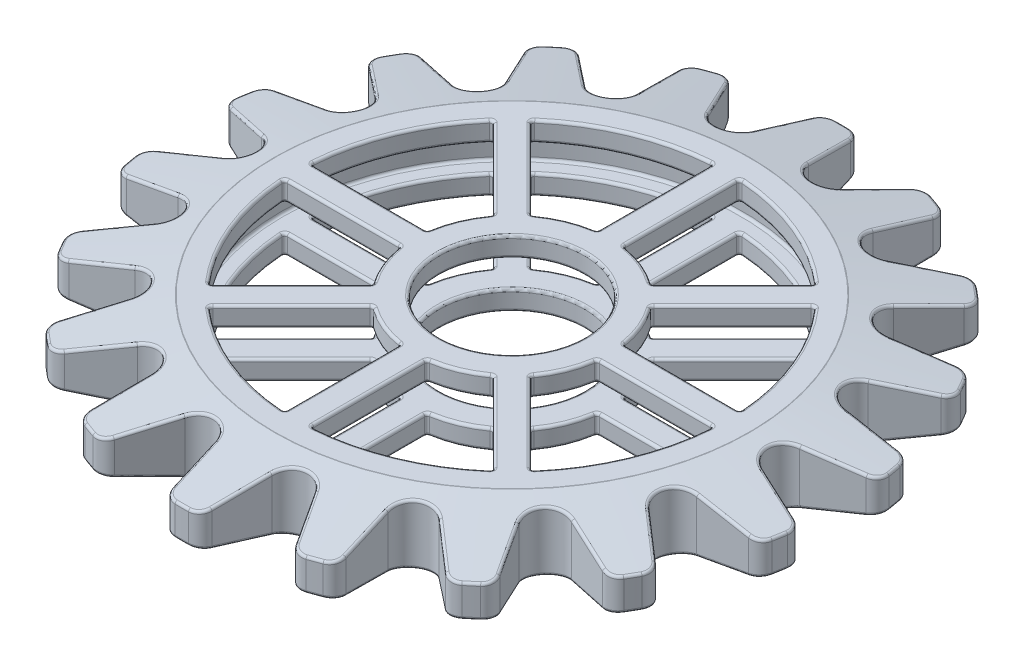
from build123d import *

# Parameters (mm, degrees)
SKETCH_6_W                       = 17.5
SKETCH_6_H                       = 9.999999999999998
CUT_REVOLVE_5_ANGLE              = 90.0000000000002
REVOLVE_2_ANGLE                  = 90.0000000000002
PATTERN_CIRCULAR_2_COUNT         = 4
PATTERN_CIRCULAR_3_COUNT         = 8
CUT_REVOLVE_START                = -5
CUT_REVOLVE_1_DEPTH              = 10
FILLET_1_R                       = 2
FILLET_2_R                       = 3
PATTERN_CIRCULAR_5_COUNT         = 18
FILLET_1_OF_PATTERN_CIRCULAR_5_R = 2
FILLET_2_OF_PATTERN_CIRCULAR_5_R = 3
FILLET_3_R                       = 0.4


with BuildPart() as part:
    # Эскиз1 → Повернуть1 (revolve)
    with BuildSketch(Plane.XY, mode=Mode.PRIVATE) as revolve_1_sk:
        Polygon((0, -5), (50, -5), (50, 4.999999999999999), (0, 5), align=None)
    revolve(revolve_1_sk.sketch.rotate(Axis((0, -5, 0), (0, 1, 0)), 90), axis=Axis((0, -5, 0), (0, 1, 0)))

    # Эскиз6 → Вырез-Повернуть5 (revolve, cut)
    with BuildSketch(Plane.XY):
        with Locations((23.75, -8.9e-16)):
            Rectangle(SKETCH_6_W, SKETCH_6_H)
    cut_revolve_5 = revolve(axis=Axis((0, -5, 0), (0, -1, 0)), revolution_arc=CUT_REVOLVE_5_ANGLE, mode=Mode.SUBTRACT)

    # Эскиз9 → Повернуть2 (revolve)
    with BuildSketch(Plane(origin=(0, 4.999999999999999, 0), x_dir=(1, 0, 0), z_dir=(0, 1, 0))):
        Polygon((26.87005768508882, -29.698484809834984), (5.656854249492397, -8.485281374238571), (8.485281374238587, -5.656854249492381), (29.698484809835012, -26.8700576850888), align=None)
    revolve_2 = revolve(axis=Axis((5.656854249492397, 4.999999999999999, 8.485281374238571), (0.7071067811865476, 0, -0.7071067811865476)), revolution_arc=REVOLVE_2_ANGLE)

    # Круговой массив2: Вырез-Повернуть5, Повернуть2 ×4 about axis
    pattern_circular_2_axis = Axis((-3e-17, 0, -2.3e-16), (0, 1, 0))
    add([cut_revolve_5.rotate(pattern_circular_2_axis, i * 360 / PATTERN_CIRCULAR_2_COUNT) for i in range(1, PATTERN_CIRCULAR_2_COUNT)], mode=Mode.SUBTRACT)
    add([revolve_2.rotate(pattern_circular_2_axis, i * 360 / PATTERN_CIRCULAR_2_COUNT) for i in range(1, PATTERN_CIRCULAR_2_COUNT)])

    # Круговой массив3: Повернуть2 ×8 about axis
    pattern_circular_3_axis = Axis((5.8e-16, 0, 2.4e-16), (0, 1, 0))
    for i in range(1, PATTERN_CIRCULAR_3_COUNT):
        add(revolve_2.rotate(pattern_circular_3_axis, i * 360 / PATTERN_CIRCULAR_3_COUNT))

    # Эскиз10 → Вырез-Повернуть6 (revolve, cut)
    with BuildSketch(Plane.XY):
        Polygon((0, -4.9999999999999964), (-50, -5), (-49.99999999999999, -34.99999999999999), (3.69e-15, -34.99999999999999), align=None)
    revolve(axis=Axis((0, -4.9999999999999964, 0), (1.2e-16, -1, 0)), mode=Mode.SUBTRACT)

    # Вырез-Повернуть1: read off the stored shape, not the designer's step
    # Вырез-Повернуть1 outline → Вырез-Повернуть1 (cut)
    with BuildSketch(Plane(origin=(0, 0, 0), x_dir=(1, 0, 0), z_dir=(0, 1, 0)).offset(CUT_REVOLVE_START)):
        with BuildLine():
            Line((-49.632183975, -6.053619898), (-33, 0))
            Line((-33, 0), (-49.632183975, 6.053619898))
            ThreePointArc((-49.632183975, 6.053619898), (-50, 0), (-49.632183975, -6.053619898))
        make_face()
    cut_revolve_1 = extrude(amount=CUT_REVOLVE_1_DEPTH, mode=Mode.SUBTRACT)

    # Скругление1
    fillet_1_edges = [part.edges().sort_by_distance(p)[0] for p in [
        (-49.632183975000004, 0, -6.053619898000001),
        (-49.63218397499999, 0, 6.053619898),
    ]]
    fillet(fillet_1_edges, radius=FILLET_1_R)

    # Скругление2
    fillet_2_edges = [part.edges().sort_by_distance(p)[0] for p in [
        (-33, 0, 0),
    ]]
    fillet(fillet_2_edges, radius=FILLET_2_R)

    # Эскиз5 → Вырез-Повернуть2 (revolve, cut)
    with BuildSketch(Plane(origin=(0, 0, 0), x_dir=(0, 0, -1), z_dir=(1, 0, 0)), mode=Mode.PRIVATE) as cut_revolve_2_sk:
        Polygon((0, 4.999999999999998), (-11, 5.000000000000007), (-10.999999999999998, -4.999999999999998), (0, -5), align=None)
    revolve(cut_revolve_2_sk.sketch.rotate(Axis((0, -5, 0), (0, 1, 0)), 180), axis=Axis((0, -5, 0), (0, 1, 0)), mode=Mode.SUBTRACT)

    # Круговой массив5: Вырез-Повернуть1 ×18 about axis
    pattern_circular_5_axis = Axis((4.6e-16, 0, -1.243e-14), (0, 1, 0))
    for i in range(1, PATTERN_CIRCULAR_5_COUNT):
        add(cut_revolve_1.rotate(pattern_circular_5_axis, i * 360 / PATTERN_CIRCULAR_5_COUNT), mode=Mode.SUBTRACT)

    # Скругление1 of Круговой массив5
    fillet_1_of_pattern_circular_5_edges = [part.edges().sort_by_distance(p)[0] for p in [
        (-48.709456979949195, 0, 11.286664729502117),
        (-44.568537089643016, 0, 22.663748623888797),
        (-41.91165059809383, 0, 27.265611017195432),
        (-34.129266869721235, 0, 36.54029478443017),
        (-30.05868060402296, 0, 39.95592221865291),
        (-19.57350337097703, 0, 46.0095421166529),
        (-14.580190110227937, 0, 47.826959513932294),
        (-2.6568864915491908, 0, 49.92935964108422),
        (2.6568864915492116, 0, 49.929359641084226),
        (14.580190110227955, 0, 47.82695951393227),
        (19.57350337097704, 0, 46.0095421166529),
        (30.058680604022957, 0, 39.955922218652894),
        (34.129266869721256, 0, 36.54029478443017),
        (41.91165059809382, 0, 27.26561101719542),
        (44.56853708964304, 0, 22.663748623888786),
        (48.70945697994919, 0, 11.286664729502098),
        (49.632183975000004, 0, 6.053619897999982),
        (49.63218397499999, 0, -6.053619898000019),
        (48.7094569799492, 0, -11.286664729502139),
        (44.56853708964302, 0, -22.663748623888818),
        (41.91165059809383, 0, -27.265611017195457),
        (34.129266869721235, 0, -36.540294784430195),
        (30.058680604022975, 0, -39.95592221865293),
        (19.573503370977047, 0, -46.00954211665292),
        (14.580190110227933, 0, -47.826959513932316),
        (2.6568864915491863, 0, -49.92935964108424),
        (-2.6568864915491948, 0, -49.92935964108426),
        (-14.580190110227937, 0, -47.82695951393231),
        (-19.573503370977058, 0, -46.00954211665293),
        (-30.058680604022975, 0, -39.95592221865291),
        (-34.12926686972124, 0, -36.5402947844302),
        (-41.91165059809382, 0, -27.265611017195447),
        (-44.568537089643044, 0, -22.663748623888797),
        (-48.709456979949195, 0, -11.286664729502109),
    ]]
    fillet(fillet_1_of_pattern_circular_5_edges, radius=FILLET_1_OF_PATTERN_CIRCULAR_5_R)

    # Скругление2 of Круговой массив5
    fillet_2_of_pattern_circular_5_edges = [part.edges().sort_by_distance(p)[0] for p in [
        (-31.009856485934975, 0, 11.286664729747068),
        (-25.279466622926268, 0, 21.211991119655792),
        (-16.499999999999993, 0, 28.578838324886465),
        (-5.730389863008691, 0, 32.49865584940286),
        (5.730389863008712, 0, 32.49865584940285),
        (16.500000000000004, 0, 28.57883832488646),
        (25.27946662292628, 0, 21.21199111965578),
        (31.00985648593498, 0, 11.28666472974705),
        (33, 0, -2.083e-14),
        (31.009856485934975, 0, -11.286664729747091),
        (25.279466622926268, 0, -21.211991119655817),
        (16.500000000000004, 0, -28.578838324886483),
        (5.730389863008689, 0, -32.49865584940288),
        (-5.730389863008701, 0, -32.49865584940288),
        (-16.500000000000014, 0, -28.57883832488648),
        (-25.279466622926275, 0, -21.21199111965581),
        (-31.009856485934982, 0, -11.286664729747066),
    ]]
    fillet(fillet_2_of_pattern_circular_5_edges, radius=FILLET_2_OF_PATTERN_CIRCULAR_5_R)

    # Эскиз11 → Вырез-Повернуть7 (revolve, cut)
    with BuildSketch(Plane.XY, mode=Mode.PRIVATE) as cut_revolve_7_sk:
        Polygon((35, -1.9999999999999922), (-4.9e-16, -2.000000000000003), (0, 1.9999999999999971), (35, 2.000000000000008), align=None)
    revolve(cut_revolve_7_sk.sketch.rotate(Axis((-4.9e-16, -2.000000000000003, 0), (1.2e-16, 1, 0)), 90), axis=Axis((-4.9e-16, -2.000000000000003, 0), (1.2e-16, 1, 0)), mode=Mode.SUBTRACT)

    # Эскиз12 → Вырез-Повернуть9 (revolve, cut)
    with BuildSketch(Plane(origin=(0, 0, 0), x_dir=(0, 0, -1), z_dir=(1, 0, 0)), mode=Mode.PRIVATE) as cut_revolve_9_sk:
        Polygon((-20, 8), (-52.00000000000001, 2), (-52.00000000000001, 10), (-20, 10), align=None)
    cut_revolve_9 = revolve(cut_revolve_9_sk.sketch.rotate(Axis((0, -5, 0), (0, -1, 0)), 270), axis=Axis((0, -5, 0), (0, -1, 0)), mode=Mode.SUBTRACT)

    # Зеркальное отражение1: Вырез-Повернуть9 across plane
    add(cut_revolve_9.mirror(Plane.ZX), mode=Mode.SUBTRACT)

    # Скругление3
    fillet_3_edges = [part.edges().sort_by_distance(p)[0] for p in [
        (-1.9999999999999885, 3.499999999999998, 32.438403166617185),
        (-1.9999999999999847, -3.499999999999994, 14.86606874731851),
        (2.0000000000000093, 3.4999999999999964, 14.866068747318506),
        (2.0000000000000053, -3.4999999999999947, 32.438403166617185),
        (-30.026084806616446, 4.999999999999998, -12.437211551866323),
        (-32.438403166617185, 3.4999999999999996, -1.9999999999999856),
        (-14.86606874731851, -3.499999999999993, -1.9999999999999836),
        (-14.866068747318506, 3.4999999999999982, 2.00000000000001),
        (-32.438403166617185, -3.499999999999991, 2.0000000000000084),
        (1.9999999999999856, 3.4999999999999973, -32.438403166617185),
        (1.9999999999999836, -3.4999999999999942, -14.86606874731851),
        (-13.858192987669472, 4.999999999999998, -5.740251485475931),
        (-2.0000000000000093, 3.4999999999999982, -14.866068747318506),
        (-2.0000000000000075, -3.4999999999999947, -32.438403166617185),
        (32.438403166617185, 3.4999999999999956, 1.9999999999999851),
        (14.86606874731851, -3.4999999999999947, 1.9999999999999831),
        (14.866068747318506, 3.4999999999999964, -2.0000000000000098),
        (32.438403166617185, -3.4999999999999964, -2.000000000000008),
        (-24.351628412351275, 3.499999999999999, 21.523201287605104),
        (-11.926111583187406, -3.4999999999999933, 9.097684458441238),
        (-9.097684458441218, 3.4999999999999982, 11.92611158318742),
        (-21.52320128760509, -3.499999999999993, 24.35162841235129),
        (-21.523201287605104, 3.499999999999999, -24.351628412351275),
        (-9.09768445844124, -3.4999999999999933, -11.926111583187406),
        (-11.926111583187422, 3.4999999999999982, -9.097684458441218),
        (-24.35162841235129, -3.499999999999993, -21.52320128760509),
        (24.351628412351275, 3.499999999999996, -21.523201287605104),
        (11.926111583187406, -3.4999999999999947, -9.09768445844124),
        (9.097684458441218, 3.4999999999999964, -11.926111583187422),
        (21.52320128760509, -3.4999999999999947, -24.35162841235129),
        (21.523201287605108, 3.4999999999999964, 24.35162841235127),
        (9.097684458441242, -3.4999999999999947, 11.926111583187405),
        (11.926111583187422, 3.4999999999999964, 9.097684458441217),
        (24.351628412351292, -3.4999999999999947, 21.523201287605087),
        (-30.026084806616815, -5, -12.437211551865417),
        (13.858192987669364, -1.999999999999988, -5.740251485476198),
        (18.13886999776932, -1.99999999999999, -15.310442873023153),
        (30.026084806616677, -1.9999999999999876, -12.437211551865756),
        (23.652235956967846, -1.9999999999999905, -2.0000000000000084),
        (30.02608480661671, -1.9999999999999876, 12.43721155186569),
        (18.138869997769337, -1.999999999999991, 15.310442873023131),
        (13.858192987669376, -1.999999999999988, 5.740251485476172),
        (23.65223595696785, -1.9999999999999905, 1.9999999999999842),
        (-5.740251485476192, -1.999999999999988, -13.858192987669367),
        (-15.31044287302315, -1.999999999999986, -18.13886999776932),
        (-12.437211551865754, -1.9999999999999876, -30.026084806616677),
        (-2.0000000000000084, -1.999999999999988, -23.652235956967846),
        (12.437211551865692, -1.9999999999999876, -30.02608480661671),
        (15.310442873023135, -1.9999999999999896, -18.13886999776934),
        (5.740251485476167, -1.999999999999988, -13.858192987669378),
        (1.9999999999999847, -1.9999999999999885, -23.65223595696785),
        (-13.858192987669367, -1.999999999999988, 5.7402514854761915),
        (-18.138869997769326, -1.9999999999999856, 15.310442873023156),
        (-30.02608480661668, -1.9999999999999876, 12.437211551865753),
        (-23.652235956967846, -1.9999999999999851, 2.0000000000000093),
        (-30.026084806616705, -1.9999999999999876, -12.437211551865694),
        (-18.13886999776934, -1.9999999999999856, -15.310442873023135),
        (-13.858192987669376, -1.999999999999988, -5.74025148547617),
        (-23.65223595696785, -1.9999999999999851, -1.9999999999999847),
        (5.740251485476178, -1.999999999999988, 13.858192987669373),
        (15.310442873023153, -1.9999999999999905, 18.138869997769316),
        (12.437211551865726, -1.9999999999999876, 30.026084806616694),
        (2.0000000000000075, -1.9999999999999885, 23.652235956967846),
        (-12.437211551865696, -1.9999999999999876, 30.026084806616705),
        (-15.310442873023137, -1.999999999999986, 18.138869997769337),
        (-5.7402514854761835, -1.999999999999988, 13.858192987669371),
        (-1.9999999999999867, -1.999999999999988, 23.65223595696785),
        (4.88e-15, -1.9999999999999876, 11),
        (30.026084806616677, 1.999999999999997, -12.437211551865756),
        (18.13886999776932, 1.999999999999995, -15.310442873023153),
        (13.858192987669364, 1.9999999999999964, -5.740251485476198),
        (23.652235956967846, 1.9999999999999942, -2.0000000000000084),
        (13.858192987669376, 1.9999999999999964, 5.740251485476172),
        (18.138869997769337, 1.9999999999999944, 15.310442873023131),
        (30.02608480661671, 1.999999999999997, 12.43721155186569),
        (23.65223595696785, 1.9999999999999942, 1.9999999999999842),
        (-12.437211551865754, 1.999999999999997, -30.026084806616677),
        (-15.31044287302315, 1.999999999999999, -18.13886999776932),
        (-5.740251485476192, 1.9999999999999964, -13.858192987669367),
        (-2.0000000000000084, 1.999999999999997, -23.652235956967846),
        (5.740251485476167, 1.9999999999999964, -13.858192987669378),
        (15.310442873023135, 1.999999999999995, -18.13886999776934),
        (12.437211551865692, 1.999999999999997, -30.02608480661671),
        (1.9999999999999847, 1.999999999999997, -23.65223595696785),
        (-30.02608480661668, 1.999999999999997, 12.437211551865753),
        (-18.138869997769326, 1.999999999999999, 15.310442873023156),
        (-13.858192987669367, 1.9999999999999964, 5.7402514854761915),
        (-23.652235956967846, 1.9999999999999996, 2.0000000000000093),
        (-13.858192987669376, 1.9999999999999964, -5.74025148547617),
        (-18.13886999776934, 1.999999999999999, -15.310442873023135),
        (-30.026084806616705, 1.999999999999997, -12.437211551865694),
        (-23.65223595696785, 1.9999999999999996, -1.9999999999999847),
        (12.437211551865726, 1.999999999999997, 30.026084806616694),
        (15.310442873023153, 1.9999999999999944, 18.138869997769316),
        (5.740251485476178, 1.9999999999999964, 13.858192987669373),
        (2.0000000000000075, 1.999999999999997, 23.652235956967846),
        (-5.7402514854761835, 1.9999999999999964, 13.858192987669371),
        (-15.310442873023137, 1.999999999999999, 18.138869997769337),
        (-12.437211551865696, 1.999999999999997, 30.026084806616705),
        (-1.9999999999999867, 1.999999999999997, 23.652235956967843),
        (4.88e-15, 1.999999999999997, 11),
        (-8.66e-15, -1.999999999999988, 35),
        (-8.17e-15, 2.000000000000013, 35),
        (-13.858192987669305, -5, -5.740251485476336),
        (-36.43321088161458, 4.480360024970334, 13.260604299699795),
        (-11.926111583187422, -3.4999999999999933, -9.097684458441218),
        (-24.35162841235129, 3.499999999999999, -21.52320128760509),
        (-9.09768445844124, 3.4999999999999982, -11.926111583187406),
        (-21.523201287605104, -3.499999999999993, -24.351628412351275),
        (-18.138869997769337, 4.999999999999999, -15.31044287302313),
        (-15.310442873023149, 4.999999999999999, -18.138869997769323),
        (-36, 5, 1.24e-14),
        (36.43321088164581, 4.480360024970332, -13.260604299614013),
        (43.17304789030424, 3.3830010738551834, -11.286664729578758),
        (39.3188977556951, 4.370592419255255, 1.7277639108030243),
        (44.429661207834805, 3.3830010738551852, 4.1600564675780785),
        (36.43321088164582, 4.480360024970335, 13.260604299613975),
        (40.32740167173636, 3.3830010738551852, 19.105013458850372),
        (29.700625633880474, 4.480360024970332, 24.92178401506396),
        (31.361062324965133, 3.3830010738551852, 31.745623867016263),
        (19.385706600118738, 4.480360024970339, 33.577028771937634),
        (18.61211602181702, 3.383001073855187, 40.55724352130998),
        (6.73258524782404, 4.480360024970335, 38.18238831474788),
        (3.6182738408601454, 3.383001073855187, 44.47706104576791),
        (-6.732585247734101, 4.480360024970332, 38.18238831476376),
        (-11.811985565339114, 3.3830010738551834, 43.032288596595),
        (-19.385706600039647, 4.480360024970334, 33.577028771983294),
        (-25.817545186017785, 3.3830010738551834, 36.3971870537319),
        (-29.700625633821787, 4.480360024970332, 24.921784015133927),
        (-36.70912783087621, 3.3830010738551852, 25.372047586917525),
        (-43.17304789030424, 3.3830010738551817, 11.286664729578735),
        (-38.77141320015838, 4.480360024970334, 4.564915e-11),
        (-44.42966120783482, 3.3830010738551817, -4.160056467578096),
        (-36.433210881614585, 4.480360024970332, -13.260604299699796),
        (-40.32740167173638, 3.38300107385518, -19.105013458850397),
        (-29.700625633821776, 4.480360024970331, -24.921784015133937),
        (-31.361062324965133, 3.38300107385518, -31.745623867016285),
        (-19.385706600039658, 4.480360024970331, -33.577028771983294),
        (-18.612116021817037, 3.383001073855187, -40.557243521309985),
        (-6.732585247734104, 4.480360024970332, -38.182388314763784),
        (-3.618273840860133, 3.3830010738551834, -44.47706104576794),
        (6.732585247824023, 4.480360024970333, -38.182388314747904),
        (11.811985565339091, 3.3830010738551852, -43.03228859659501),
        (19.38570660011873, 4.480360024970331, -33.57702877193765),
        (25.817545186017803, 3.3830010738551817, -36.39718705373191),
        (29.70062563388046, 4.4803600249703335, -24.921784015063995),
        (36.70912783087623, 3.3830010738551834, -25.372047586917557),
        (40.32740167173635, 3.3830010738551834, -19.105013458850404),
        (44.00952562720524, 2.4580333673617933, -22.78318026086138),
        (43.301270189221924, 2.375, -25.00000000000001),
        (41.73557570637224, 2.4580333644808743, -26.72177708994408),
        (31.36106232496511, 3.3830010738551834, -31.745623867016278),
        (33.56311989793873, 2.458033367361798, -36.46133063187802),
        (32.13938048432699, 2.375, -38.30222215594888),
        (30.079226485310397, 2.458033364480879, -39.38466433057912),
        (18.612116021817027, 3.3830010738551817, -40.557243521310006),
        (19.068506570086225, 2.458033367361794, -45.741706416760586),
        (17.101007166283445, 2.375, -46.984631039295415),
        (14.794878628016193, 2.4580333644808805, -47.2971797972063),
        (3.6182738408601223, 3.3830010738551834, -44.47706104576793),
        (2.273949928696502, 2.4580333673617947, -49.5049573320927),
        (5.053e-14, 2.375, -50),
        (-2.2739499409704473, 2.458033364480876, -49.50495734825906),
        (-11.811985565339105, 3.38300107385518, -43.03228859659501),
        (-14.79487863402069, 2.458033367361798, -47.29717977781693),
        (-17.10100716628341, 2.375, -46.98463103929543),
        (-19.068506587149177, 2.458033364480877, -45.741706427754046),
        (-25.817545186017785, 3.3830010738551852, -36.397187053731884),
        (-30.079226484321218, 2.4580333673618004, -39.3846643103054),
        (-32.13938048432689, 2.375, -38.30222215594896),
        (-33.56311991773267, 2.4580333644808787, -36.46133063637266),
        (-36.70912783087622, 3.3830010738551852, -25.372047586917546),
        (-41.735575698508725, 2.4580333673617965, -26.721777071231354),
        (-43.30127018922192, 2.375, -25.00000000000002),
        (-44.0095256473427, 2.4580333644808796, -22.78318025831499),
        (-43.17304789030424, 3.3830010738551817, -11.28666472957873),
        (-48.35799853195943, 2.4580333673617996, -10.835849145938921),
        (-49.24038765061039, 2.375, -8.682408883346604),
        (-49.14773305440745, 2.4580333673617947, -6.357042106455176),
        (-44.42966120783482, 3.3830010738551817, 4.160056467578096),
        (-49.147733054407446, 2.458033367361796, 6.357042106455171),
        (-49.24038765061041, 2.375, 8.682408883346499),
        (-48.357998545748835, 2.4580333644808823, 10.835849160833632),
        (-40.32740167173636, 3.3830010738551834, 19.105013458850394),
        (-44.009525627205235, 2.458033367361796, 22.783180260861382),
        (-43.30127018922191, 2.375, 25.000000000000043),
        (-41.73557570637223, 2.4580333644808827, 26.721777089944105),
        (-31.361062324965125, 3.38300107385518, 31.745623867016274),
        (-33.56311989793874, 2.458033367361798, 36.46133063187801),
        (-32.13938048432698, 2.375, 38.30222215594889),
        (-30.07922648531036, 2.4580333644808836, 39.384664330579106),
        (-18.612116021817016, 3.3830010738551834, 40.55724352131),
        (-19.068506570086207, 2.4580333673617965, 45.741706416760586),
        (-17.10100716628343, 2.375, 46.98463103929542),
        (-14.794878628016177, 2.4580333644808783, 47.297179797206276),
        (-3.6182738408601223, 3.3830010738551834, 44.477061045767925),
        (-2.2739499286964886, 2.458033367361793, 49.50495733209271),
        (-1.225e-14, 2.375, 50),
        (2.2739499409704655, 2.458033364480877, 49.50495734825906),
        (11.811985565339128, 3.3830010738551817, 43.032288596595),
        (14.79487863402074, 2.4580333673617925, 47.29717977781693),
        (17.101007166283427, 2.375, 46.98463103929542),
        (19.068506587149148, 2.4580333644808787, 45.741706427754046),
        (25.817545186017814, 3.3830010738551817, 36.397187053731905),
        (30.079226484321243, 2.4580333673617947, 39.38466431030542),
        (32.13938048432697, 2.375, 38.3022221559489),
        (33.563119917732664, 2.4580333644808783, 36.46133063637262),
        (36.70912783087623, 3.3830010738551834, 25.372047586917517),
        (41.73557569850873, 2.4580333673617982, 26.72177707123133),
        (43.30127018922192, 2.375, 25.00000000000002),
        (44.00952564734269, 2.458033364480876, 22.783180258315),
        (43.17304789030423, 3.3830010738551834, 11.286664729578717),
        (48.35799853195945, 2.458033367361798, 10.8358491459389),
        (49.2403876506104, 2.375, 8.68240888334652),
        (49.14773307245954, 2.458033364480879, 6.357042097174931),
        (44.429661207834805, 3.3830010738551834, -4.160056467578114),
        (49.147733054407446, 2.4580333673617956, -6.357042106455193),
        (49.2403876506104, 2.375, -8.682408883346538),
        (48.35799854574884, 2.4580333644808796, -10.835849160833664),
        (13.858192987669472, 4.999999999999998, 5.740251485475931),
        (-36.43321088161458, -4.480360024970338, 13.260604299699795),
        (13.858192987669307, -5, 5.7402514854763345),
        (-5.740251485475939, 4.999999999999998, 13.858192987669472),
        (-12.437211551866309, 4.999999999999998, 30.026084806616453),
        (30.026084806616822, -5, 12.43721155186541),
        (-12.43721155186542, -5, 30.02608480661682),
        (30.02608480661645, 4.999999999999998, 12.43721155186632),
        (-36, -5, 3.58e-15),
        (43.17304789030424, -3.3830010738551834, -11.286664729578758),
        (36.43321088164583, -4.480360024970332, -13.260604299614009),
        (36.709127830876206, -3.383001073855187, -25.37204758691755),
        (29.700625633880456, -4.4803600249703335, -24.921784015063995),
        (25.817545186017803, -3.3830010738551817, -36.39718705373191),
        (19.385706600118723, -4.480360024970334, -33.57702877193764),
        (11.811985565339091, -3.3830010738551852, -43.03228859659501),
        (6.732585247824027, -4.480360024970332, -38.18238831474791),
        (-3.6182738408601303, -3.38300107385518, -44.477061045767954),
        (-6.732585247734101, -4.480360024970332, -38.182388314763784),
        (-18.612116021817037, -3.3830010738551834, -40.55724352131),
        (-19.38570660003966, -4.480360024970334, -33.577028771983294),
        (-31.361062324965133, -3.38300107385518, -31.745623867016285),
        (-29.700625633821772, -4.4803600249703335, -24.92178401513393),
        (-40.32740167173638, -3.38300107385518, -19.105013458850397),
        (-36.43321088161458, -4.480360024970334, -13.26060429969979),
        (-44.42966120783482, -3.3830010738551817, -4.160056467578096),
        (-38.77141320015837, -4.480360024970338, 4.565226e-11),
        (-43.17304789030424, -3.3830010738551817, 11.286664729578735),
        (-36.709127830876234, -3.3830010738551817, 25.37204758691753),
        (-29.700625633821783, -4.4803600249703335, 24.921784015133923),
        (-25.817545186017785, -3.3830010738551834, 36.3971870537319),
        (-19.38570660003965, -4.480360024970338, 33.577028771983294),
        (-11.811985565339114, -3.3830010738551834, 43.032288596595),
        (-6.732585247734099, -4.480360024970334, 38.18238831476377),
        (3.6182738408601436, -3.3830010738551834, 44.477061045767925),
        (6.732585247824037, -4.480360024970338, 38.18238831474788),
        (18.612116021817023, -3.3830010738551834, 40.55724352131),
        (19.38570660011873, -4.480360024970339, 33.577028771937634),
        (31.361062324965133, -3.3830010738551852, 31.745623867016263),
        (29.700625633880474, -4.4803600249703335, 24.92178401506396),
        (40.32740167173636, -3.3830010738551852, 19.105013458850372),
        (36.43321088164581, -4.480360024970336, 13.260604299613975),
        (44.429661207834805, -3.3830010738551852, 4.1600564675780785),
        (39.31889775338724, -4.3705924197092445, -1.7277639123970832),
        (48.35799854574885, -2.4580333644808796, -10.835849160833671),
        (49.2403876506104, -2.375, -8.682408883346538),
        (49.14773305440744, -2.458033367361798, -6.357042106455189),
        (44.429661207834805, -3.3830010738551834, -4.160056467578114),
        (49.14773307245954, -2.458033364480882, 6.357042097174932),
        (49.2403876506104, -2.375, 8.68240888334652),
        (48.35799853195945, -2.458033367361799, 10.835849145938896),
        (43.17304789030423, -3.3830010738551834, 11.286664729578717),
        (44.00952564734269, -2.458033364480876, 22.783180258315),
        (43.30127018922192, -2.375, 25.00000000000002),
        (41.73557569850873, -2.458033367361799, 26.72177707123133),
        (36.70912783087623, -3.3830010738551834, 25.372047586917517),
        (33.56311991773267, -2.458033364480883, 36.46133063637262),
        (32.13938048432697, -2.375, 38.3022221559489),
        (30.079226484321243, -2.458033367361796, 39.38466431030542),
        (25.817545186017792, -3.3830010738551852, 36.397187053731884),
        (19.068506587149148, -2.4580333644808787, 45.741706427754046),
        (17.101007166283463, -2.375, 46.98463103929541),
        (14.79487863402074, -2.4580333673617947, 47.29717977781693),
        (11.811985565339128, -3.3830010738551817, 43.032288596595),
        (2.2739499409704615, -2.45803336448088, 49.50495734825906),
        (-1.225e-14, -2.375, 50),
        (-2.273949928696488, -2.4580333673617947, 49.50495733209271),
        (-3.6182738408601223, -3.3830010738551834, 44.477061045767925),
        (-14.794878628016185, -2.4580333644808823, 47.29717979720626),
        (-17.10100716628343, -2.375, 46.98463103929542),
        (-19.068506570086207, -2.4580333673617973, 45.74170641676058),
        (-18.612116021817013, -3.383001073855187, 40.55724352130998),
        (-30.079226485310365, -2.4580333644808854, 39.3846643305791),
        (-32.13938048432698, -2.375, 38.30222215594889),
        (-33.56311989793875, -2.4580333673617973, 36.46133063187801),
        (-31.36106232496512, -3.3830010738551834, 31.74562386701626),
        (-41.73557570637221, -2.4580333644808823, 26.72177708994405),
        (-43.30127018922191, -2.375, 25.000000000000043),
        (-44.009525627205235, -2.4580333673617965, 22.783180260861382),
        (-40.32740167173636, -3.3830010738551834, 19.105013458850394),
        (-48.35799854574884, -2.4580333644808867, 10.835849160833636),
        (-49.24038765061041, -2.375, 8.682408883346499),
        (-49.147733054407446, -2.458033367361797, 6.357042106455171),
        (-44.42966120783482, -3.3830010738551817, 4.160056467578096),
        (-49.14773305440745, -2.458033367361797, -6.357042106455174),
        (-49.24038765061039, -2.375, -8.682408883346604),
        (-48.35799853195943, -2.4580333673618013, -10.835849145938923),
        (-43.17304789030424, -3.3830010738551817, -11.28666472957873),
        (-44.00952564734269, -2.458033364480879, -22.78318025831499),
        (-43.30127018922192, -2.375, -25.00000000000002),
        (-41.735575698508725, -2.458033367361798, -26.72177707123135),
        (-36.70912783087622, -3.3830010738551852, -25.372047586917546),
        (-33.563119917732664, -2.458033364480876, -36.46133063637265),
        (-32.13938048432689, -2.375, -38.30222215594896),
        (-30.079226484321218, -2.458033367361802, -39.3846643103054),
        (-25.817545186017785, -3.3830010738551852, -36.397187053731884),
        (-19.06850658714917, -2.4580333644808765, -45.741706427754046),
        (-17.10100716628341, -2.375, -46.98463103929543),
        (-14.79487863402069, -2.4580333673617987, -47.29717977781693),
        (-11.811985565339105, -3.38300107385518, -43.03228859659501),
        (-2.273949940970461, -2.4580333644808774, -49.50495734825908),
        (5.053e-14, -2.375, -50),
        (2.2739499286965, -2.4580333673617965, -49.5049573320927),
        (3.6182738408601223, -3.3830010738551834, -44.47706104576793),
        (14.794878628016193, -2.45803336448088, -47.2971797972063),
        (17.101007166283445, -2.375, -46.984631039295415),
        (19.06850657008622, -2.4580333673617956, -45.74170641676058),
        (18.612116021817027, -3.3830010738551817, -40.557243521310006),
        (30.079226485310397, -2.4580333644808774, -39.38466433057912),
        (32.13938048432699, -2.375, -38.30222215594888),
        (33.56311989793873, -2.458033367361798, -36.46133063187802),
        (31.36106232496511, -3.3830010738551834, -31.745623867016278),
        (41.73557570637224, -2.458033364480873, -26.721777089944084),
        (43.301270189221924, -2.375, -25.00000000000001),
        (44.009525627205235, -2.458033367361795, -22.783180260861382),
        (40.32740167173635, -3.3830010738551834, -19.105013458850404),
        (-5.740251485476343, -5, 13.858192987669304),
        (-9.097684458441218, -3.4999999999999933, 11.92611158318742),
        (-21.52320128760509, 3.499999999999999, 24.35162841235129),
        (-11.926111583187406, 3.4999999999999982, 9.097684458441238),
        (-24.351628412351275, -3.499999999999993, 21.523201287605104),
        (-15.310442873023135, 4.999999999999999, 18.138869997769337),
        (-18.13886999776933, 4.999999999999999, 15.310442873023153),
        (30.026084806616815, -5, -12.437211551865424),
        (30.02608480661644, 4.999999999999998, -12.437211551866342),
        (32.438403166617185, -3.4999999999999964, 1.9999999999999851),
        (32.438403166617185, 3.4999999999999956, -2.000000000000008),
        (13.858192987669467, 4.999999999999998, -5.7402514854759525),
        (13.858192987669298, -5, -5.74025148547636),
        (14.866068747318506, -3.4999999999999947, -2.0000000000000098),
        (14.86606874731851, 3.4999999999999964, 1.9999999999999831),
        (23.652235956967807, 4.999999999999999, -2.000000000000012),
        (23.652235956967814, 4.999999999999999, 1.999999999999988),
        (-12.43721155186634, 4.999999999999998, -30.02608480661644),
        (-5.7402514854759445, 4.999999999999998, -13.858192987669469),
        (-12.437211551865415, -5, -30.02608480661682),
        (-5.740251485476359, -5, -13.858192987669298),
        (-2.0000000000000093, -3.499999999999994, -14.866068747318506),
        (-2.0000000000000075, 3.499999999999998, -32.438403166617185),
        (1.9999999999999836, 3.4999999999999964, -14.86606874731851),
        (1.9999999999999856, -3.4999999999999947, -32.438403166617185),
        (-2.0000000000000115, 4.999999999999999, -23.652235956967807),
        (1.9999999999999885, 4.999999999999999, -23.652235956967814),
        (21.523201287605108, -3.4999999999999947, 24.35162841235127),
        (24.351628412351292, 3.499999999999996, 21.523201287605087),
        (-30.026084806616442, 4.999999999999998, 12.437211551866339),
        (-13.858192987669465, 4.999999999999998, 5.740251485475958),
        (-30.02608480661682, -5, 12.437211551865415),
        (-13.858192987669295, -5, 5.740251485476364),
        (-14.866068747318506, -3.499999999999993, 2.00000000000001),
        (-32.438403166617185, 3.4999999999999996, 2.0000000000000084),
        (-14.86606874731851, 3.4999999999999982, -1.9999999999999836),
        (-32.438403166617185, -3.499999999999991, -1.9999999999999856),
        (-23.652235956967818, 4.999999999999999, 2.000000000000009),
        (-23.652235956967818, 4.999999999999999, -1.9999999999999911),
        (12.437211551866312, 4.999999999999998, 30.026084806616453),
        (5.740251485475944, 4.999999999999998, 13.85819298766947),
        (12.437211551865413, -5, 30.026084806616822),
        (5.740251485476351, -5, 13.858192987669302),
        (2.0000000000000093, -3.4999999999999942, 14.866068747318506),
        (2.0000000000000053, 3.4999999999999973, 32.438403166617185),
        (-1.9999999999999847, 3.4999999999999982, 14.86606874731851),
        (-1.9999999999999885, -3.4999999999999947, 32.438403166617185),
        (2.0000000000000075, 4.999999999999999, 23.652235956967814),
        (-1.9999999999999925, 4.999999999999999, 23.652235956967814),
        (2.0000000000000075, -4.9999999999999964, 23.652235956967846),
        (15.310442873023177, -4.999999999999995, 18.13886999776934),
        (-23.652235956967843, -4.999999999999999, 2.0000000000000093),
        (-18.13886999776934, -4.999999999999998, 15.31044287302317),
        (-2.0000000000000084, -4.9999999999999964, -23.652235956967846),
        (-15.310442873023172, -4.999999999999998, -18.13886999776934),
        (23.652235956967846, -4.999999999999994, -2.0000000000000084),
        (18.13886999776934, -4.999999999999995, -15.310442873023172),
        (-15.310442873023156, -4.999999999999998, 18.138869997769355),
        (-1.9999999999999867, -4.9999999999999964, 23.65223595696785),
        (-18.13886999776936, -4.999999999999998, -15.310442873023156),
        (-23.652235956967846, -4.999999999999999, -1.9999999999999847),
        (15.310442873023156, -4.999999999999995, -18.13886999776936),
        (1.9999999999999847, -4.9999999999999964, -23.65223595696785),
        (18.138869997769362, -4.999999999999995, 15.310442873023156),
        (23.65223595696785, -4.999999999999994, 1.9999999999999842),
        (11.926111583187422, -3.4999999999999947, 9.097684458441217),
        (9.097684458441242, 3.4999999999999964, 11.926111583187405),
        (18.13886999776934, 4.999999999999999, 15.310442873023128),
        (15.310442873023149, 4.999999999999999, 18.13886999776932),
        (-7.58e-15, 5.000000000000007, 11),
        (-2.69e-15, -4.999999999999998, 10.999999999999998),
        (12.43721155186541, -5, -30.026084806616822),
        (12.437211551866316, 4.999999999999998, -30.026084806616453),
        (24.351628412351275, -3.4999999999999947, -21.523201287605104),
        (21.52320128760509, 3.4999999999999964, -24.35162841235129),
        (5.74025148547593, 4.999999999999998, -13.858192987669474),
        (5.740251485476335, -5, -13.858192987669307),
        (9.097684458441218, -3.4999999999999947, -11.926111583187422),
        (11.926111583187406, 3.4999999999999964, -9.09768445844124),
        (15.310442873023133, 4.999999999999999, -18.13886999776934),
        (18.138869997769323, 4.999999999999999, -15.310442873023153),
    ]]
    fillet(fillet_3_edges, radius=FILLET_3_R)


solid = part.part
